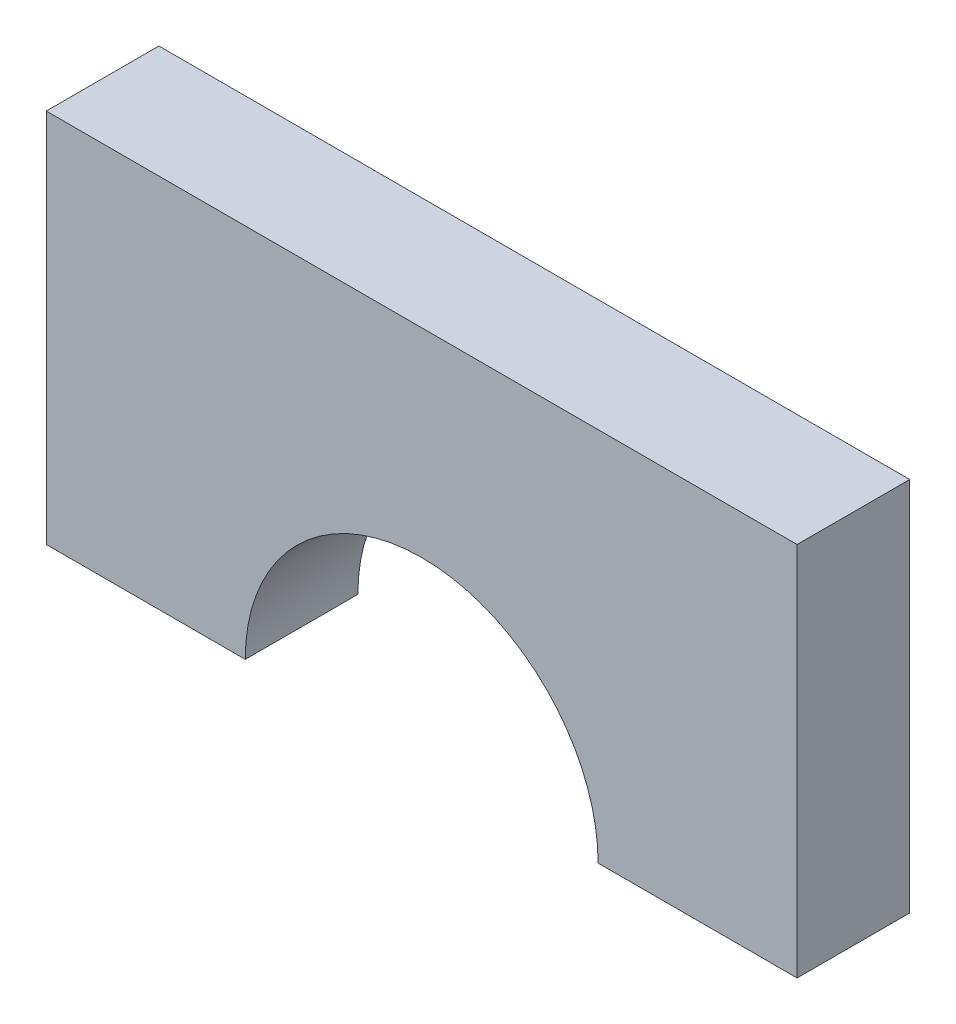
from build123d import *

# Parameters (mm, degrees)
BOSS_EXTRU_1_DEPTH = 15


with BuildPart() as part:
    # Esquisse1 → Boss.-Extru.1 (new body)
    with BuildSketch(Plane.XY):
        with BuildLine():
            Line((23.840834027, 33.881170336), (-76.159165973, 33.881170336))
            Line((-76.159165973, 33.881170336), (-76.159165973, -16.118829664))
            Line((-76.159165973, -16.118829664), (-49.659165973, -16.118829664))
            ThreePointArc((-49.659165973, -16.118829664), (-26.159165973, 7.381170336), (-2.659165973, -16.118829664))
            Line((-2.659165973, -16.118829664), (23.840834027, -16.118829664))
            Line((23.840834027, -16.118829664), (23.840834027, 33.881170336))
        make_face()
    extrude(amount=BOSS_EXTRU_1_DEPTH)


solid = part.part
